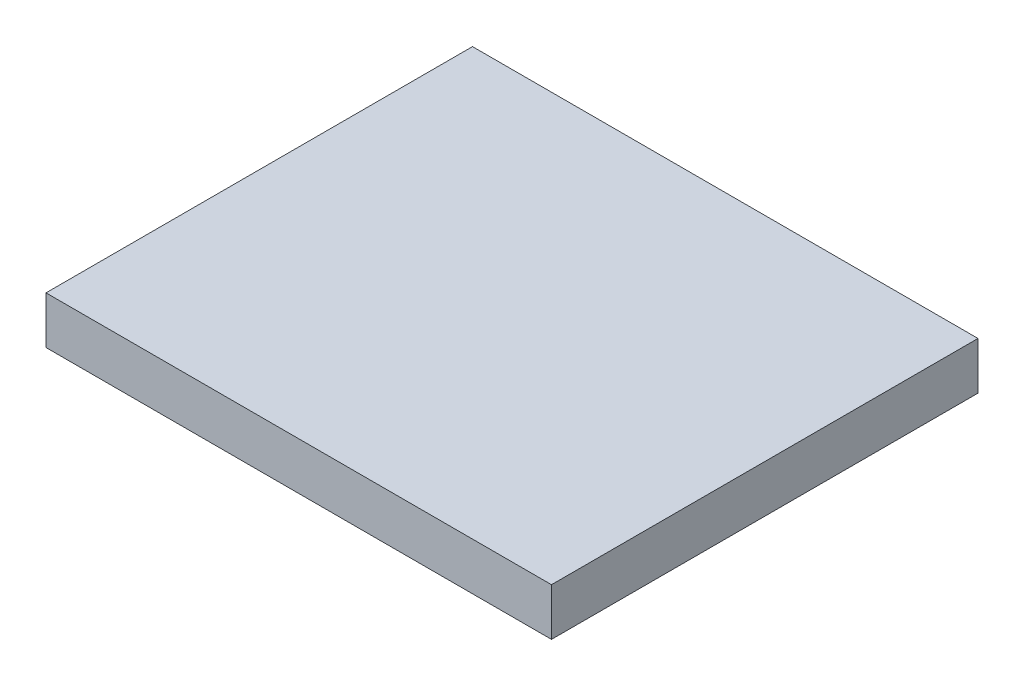
from build123d import *

# Parameters (mm, degrees)
SKETCH1_W           = 203.2
SKETCH1_H           = 171.45
BOSS_EXTRUDE1_DEPTH = 19.05


with BuildPart() as part:
    # Sketch1 → Boss-Extrude1 (new body)
    with BuildSketch(Plane(origin=(0, 0, 0), x_dir=(1, 0, 0), z_dir=(0, 1, 0))):
        with Locations((52.964992984, -26.229748699)):
            Rectangle(SKETCH1_W, SKETCH1_H)
    extrude(amount=BOSS_EXTRUDE1_DEPTH)


solid = part.part
